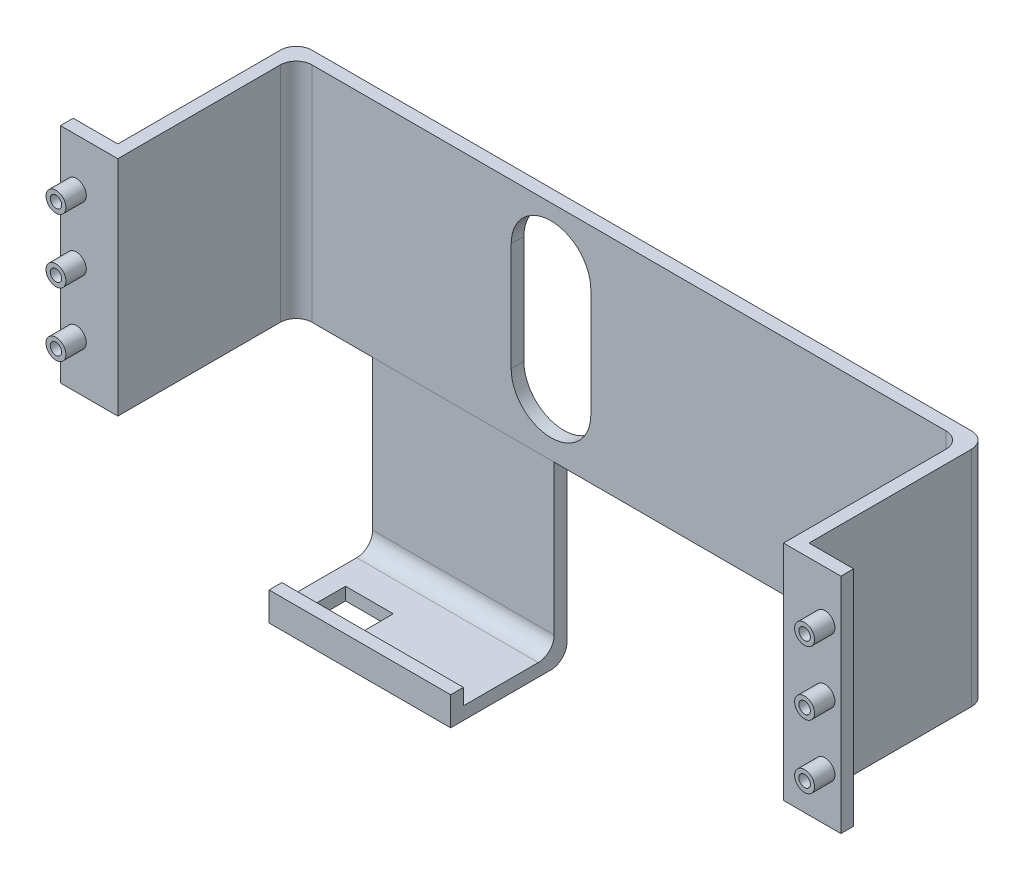
from build123d import *
from build123d.topology import SkipClean

# Parameters (mm, degrees)
BOSS_EXTRUDE1_DEPTH = 70
SKETCH2_R           = 1.8
CUT_EXTRUDE1_DEPTH  = 261.88503215
CUT_EXTRUDE2_REACH  = 262.885
SKETCH4_W           = 57
SKETCH4_H           = 56
BOSS_EXTRUDE2_DEPTH = 36.5
CUT_EXTRUDE3_DEPTH  = 173.673101553
FILLET1_R           = 5
FILLET2_R           = 5
SKETCH6_W           = 15
SKETCH6_H           = 10
CUT_EXTRUDE4_DEPTH  = 282.959216909
SKETCH7_R           = 3.125
SKETCH7_R_2         = 1.8
BOSS_EXTRUDE4_DEPTH = 6.4


with BuildPart() as part:
    # Sketch1 → Boss-Extrude1 (new body)
    with BuildSketch(Plane(origin=(0, 0, 0), x_dir=(1, 0, 0), z_dir=(0, 1, 0))):
        Polygon((0, 0), (18, 0), (18, 56), (227, 56), (227, 0), (245, 0), (245, 4), (231, 4), (231, 60), (14, 60), (14, 4), (0, 4), align=None)
    extrude(amount=BOSS_EXTRUDE1_DEPTH)

    # Sketch2 → Cut-Extrude1 (cut, through all)
    with BuildSketch(Plane(origin=(0, 0, -4), x_dir=(-1, 0, 0), z_dir=(0, 0, -1))):
        with Locations((-240.02, 55)):
            Circle(SKETCH2_R)
        with Locations((-240.02, 35)):
            Circle(SKETCH2_R)
        with Locations((-240.02, 15)):
            Circle(SKETCH2_R)
        with Locations((-4.98, 15)):
            Circle(SKETCH2_R)
        with Locations((-4.98, 35)):
            Circle(SKETCH2_R)
        with Locations((-4.98, 55)):
            Circle(SKETCH2_R)
    extrude(amount=-CUT_EXTRUDE1_DEPTH, mode=Mode.SUBTRACT)

    # Sketch3 → Cut-Extrude2 (cut, up to next)
    with BuildSketch(Plane.XY.offset(-56), mode=Mode.PRIVATE) as cut_extrude2_sk1:
        with BuildLine():
            Line((110.5, 52.616114621), (110.5, 18.63325521))
            ThreePointArc((110.5, 18.63325521), (98, 6.13325521), (85.5, 18.63325521))
            Line((85.5, 18.63325521), (85.5, 52.616114621))
            ThreePointArc((85.5, 52.616114621), (98, 65.116114621), (110.5, 52.616114621))
        make_face()
    cut_extrude2_tool1 = extrude(cut_extrude2_sk1.sketch, amount=-CUT_EXTRUDE2_REACH, mode=Mode.PRIVATE) & part.part
    add(cut_extrude2_tool1.solids().sort_by_distance((98, 35.624685, -56))[0], mode=Mode.SUBTRACT)

    # Fillet1
    fillet1_edges = [part.edges().sort_by_distance(p)[0] for p in [
        (227, 35, -56),
        (18, 35, -56),
        (14, 35, -60),
        (231, 35, -60),
    ]]
    fillet(fillet1_edges, radius=FILLET1_R)

    # Sketch7 → Boss-Extrude4 (add)
    # profile 1 of 6: a face of its own
    with SkipClean():  # the faces are left unmerged after this step: merging them gives an invalid solid
        with BuildSketch(Plane.XY):
            with Locations((4.98, 55)):
                Circle(SKETCH7_R)
            with Locations((4.98, 55)):
                Circle(SKETCH7_R_2, mode=Mode.SUBTRACT)
        # profile 2 of 6: a face of its own
        with BuildSketch(Plane.XY):
            with Locations((4.98, 35)):
                Circle(SKETCH7_R)
            with Locations((4.98, 35)):
                Circle(SKETCH7_R_2, mode=Mode.SUBTRACT)
        # profile 3 of 6: a face of its own
        with BuildSketch(Plane.XY):
            with Locations((4.98, 15)):
                Circle(SKETCH7_R)
            with Locations((4.98, 15)):
                Circle(SKETCH7_R_2, mode=Mode.SUBTRACT)
        # profile 4 of 6: a face of its own
        with BuildSketch(Plane.XY):
            with Locations((240.02, 15)):
                Circle(SKETCH7_R)
            with Locations((240.02, 15)):
                Circle(SKETCH7_R_2, mode=Mode.SUBTRACT)
        # profile 5 of 6: a face of its own
        with BuildSketch(Plane.XY):
            with Locations((240.02, 35)):
                Circle(SKETCH7_R)
            with Locations((240.02, 35)):
                Circle(SKETCH7_R_2, mode=Mode.SUBTRACT)
        # profile 6 of 6: a face of its own
        with BuildSketch(Plane.XY):
            with Locations((240.02, 55)):
                Circle(SKETCH7_R)
            with Locations((240.02, 55)):
                Circle(SKETCH7_R_2, mode=Mode.SUBTRACT)
        extrude(amount=BOSS_EXTRUDE4_DEPTH)


with BuildPart() as body_2:
    # Sketch4 → Boss-Extrude2 (new body)
    with BuildSketch(Plane(origin=(0, 0, -60), x_dir=(-1, 0, 0), z_dir=(0, 0, -1))):
        with Locations((-70.5, -28)):
            Rectangle(SKETCH4_W, SKETCH4_H)
    extrude(amount=-BOSS_EXTRUDE2_DEPTH)

    # Sketch5 → Cut-Extrude3 (cut, through all)
    with BuildSketch(Plane(origin=(99, 0, 0), x_dir=(0, 0, -1), z_dir=(1, 0, 0))):
        Polygon((23.5, 0), (56, 0), (56, -52), (27.5, -52), (27.5, -47), (23.5, -47), align=None)
    extrude(amount=-CUT_EXTRUDE3_DEPTH, mode=Mode.SUBTRACT)

    # Fillet2
    fillet2_edges = [body_2.edges().sort_by_distance(p)[0] for p in [
        (70.5, -56, -60),
        (70.5, -52, -56),
    ]]
    fillet(fillet2_edges, radius=FILLET2_R)

    # Sketch6 → Cut-Extrude4 (cut, through all)
    with BuildSketch(Plane.XZ.offset(56)):
        with Locations((55.5, -36.5)):
            Rectangle(SKETCH6_W, SKETCH6_H)
    extrude(amount=-CUT_EXTRUDE4_DEPTH, mode=Mode.SUBTRACT)


solid = Compound([part.part, body_2.part])
